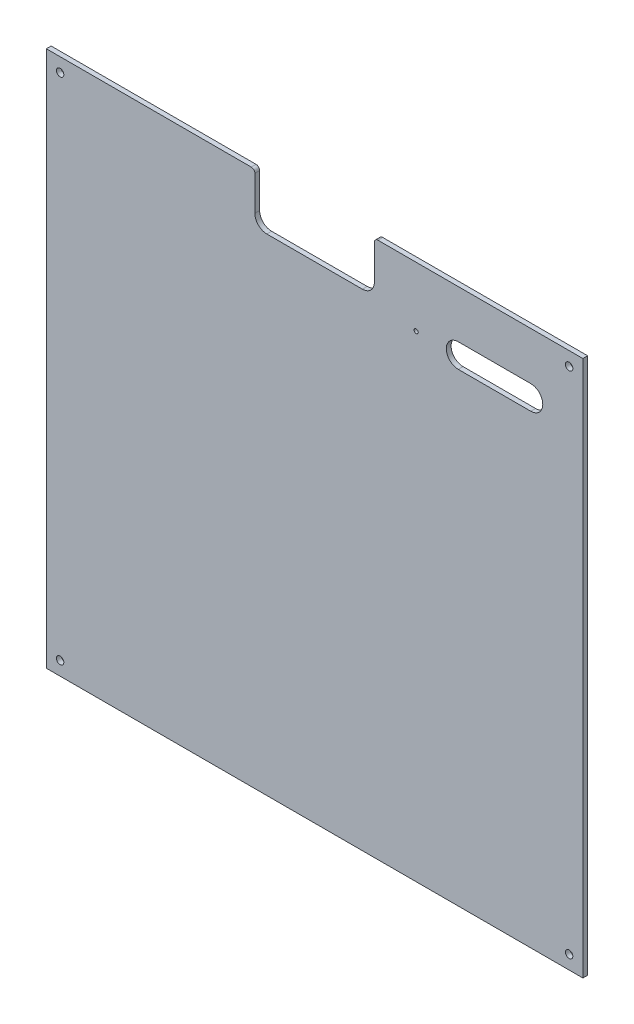
from build123d import *

# Parameters (mm, degrees)
SCHIZZO1_R                   = 3.1
SCHIZZO1_R_2                 = 1.75
ESTRUSIONE_ESTRUSIONE1_DEPTH = 4


with BuildPart() as part:
    # Schizzo1 → Estrusione-Estrusione1 (new body)
    with BuildSketch(Plane.XY):
        with BuildLine():
            Line((0, 0), (0, 449))
            Line((0, 449), (171.5, 449))
            ThreePointArc((171.5, 449), (173.621320344, 448.121320344), (174.5, 446))
            Line((174.5, 446), (174.5, 417))
            ThreePointArc((174.5, 417), (177.428932188, 409.928932188), (184.5, 407))
            Line((184.5, 407), (264.5, 407))
            ThreePointArc((264.5, 407), (271.571067812, 409.928932188), (274.5, 417))
            Line((274.5, 417), (274.5, 446))
            ThreePointArc((274.5, 446), (275.378679656, 448.121320344), (277.5, 449))
            Line((277.5, 449), (449, 449))
            Line((449, 449), (449, 0))
            Line((449, 0), (0, 0))
        make_face()
        with Locations((11.5, 11.5)):
            Circle(SCHIZZO1_R, mode=Mode.SUBTRACT)
        with Locations((437.5, 11.5)):
            Circle(SCHIZZO1_R, mode=Mode.SUBTRACT)
        with Locations((437.5, 437.5)):
            Circle(SCHIZZO1_R, mode=Mode.SUBTRACT)
        with Locations((11.5, 437.5)):
            Circle(SCHIZZO1_R, mode=Mode.SUBTRACT)
        with Locations((309.5, 399)):
            Circle(SCHIZZO1_R_2, mode=Mode.SUBTRACT)
        with BuildLine():
            Line((344.715899345, 409), (405.440355678, 409))
            ThreePointArc((405.440355678, 409), (415.440355678, 399), (405.440355678, 389))
            Line((405.440355678, 389), (344.715899345, 389))
            ThreePointArc((344.715899345, 389), (334.715899345, 399), (344.715899345, 409))
        make_face(mode=Mode.SUBTRACT)
    extrude(amount=ESTRUSIONE_ESTRUSIONE1_DEPTH)


solid = part.part
